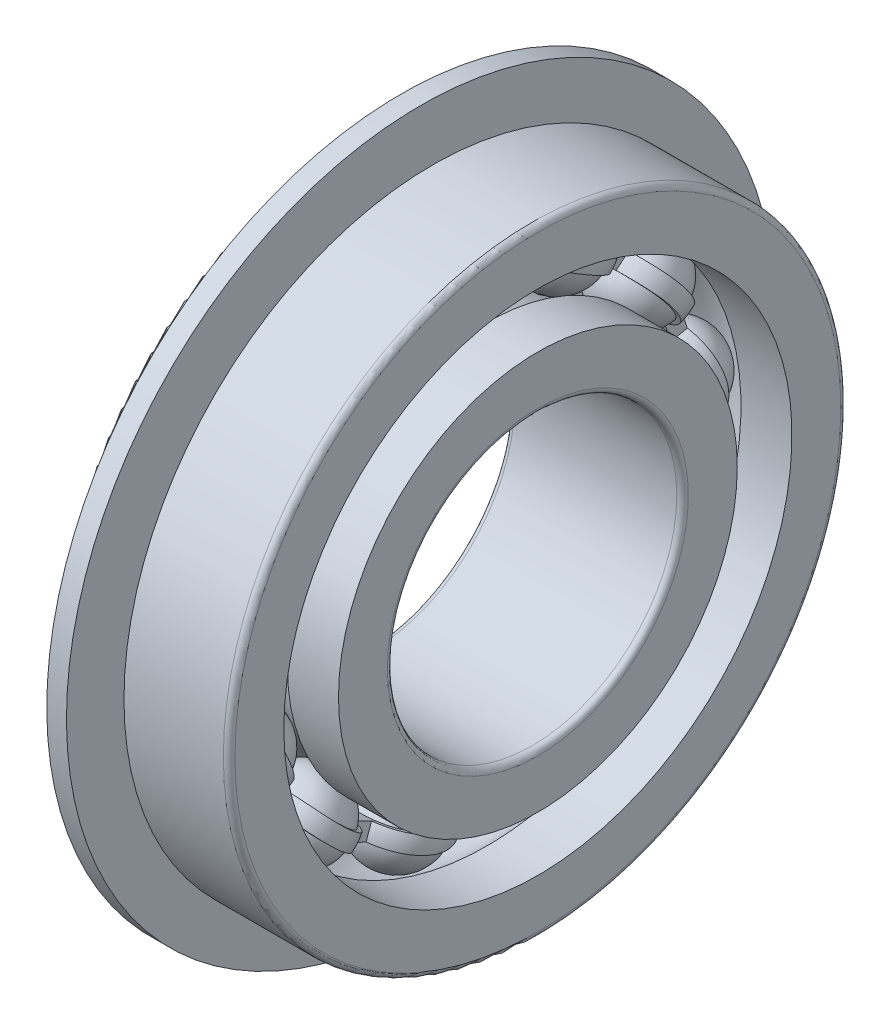
from build123d import *
from build123d.topology import SkipClean

# Parameters (mm, degrees)
SKETCH_5_W               = 1.275
SKETCH_5_H               = 0.85
PATTERN_CIRCULAR_5_COUNT = 13
PATTERN_CIRCULAR_2_COUNT = 13
SKETCH_8_W               = 1.65
SKETCH_8_H               = 1.05
CUT_EXTRUDE_START        = -1.58
CUT_EXTRUDE_1_DEPTH      = 1.02
FILLET_1_R               = 0.4


with BuildPart() as part:
    # 草图2 → 旋转1 (revolve)
    with BuildSketch(Plane.XY, mode=Mode.PRIVATE) as revolve_1_sk:
        with BuildLine():
            Line((-4.5, 13.466666667), (-4.5, 13.166666667))
            Line((-4.5, 13.166666667), (-4.2, 13.166666667))
            Line((-4.2, 13.166666667), (-1.583881484, 13.166666667))
            ThreePointArc((-1.583881484, 13.166666667), (0, 13.875), (1.583881484, 13.166666667))
            Line((1.583881484, 13.166666667), (4.2, 13.166666667))
            Line((4.2, 13.166666667), (4.5, 13.166666667))
            Line((4.5, 13.166666667), (4.5, 13.466666667))
            Line((4.5, 13.466666667), (4.5, 15.7))
            ThreePointArc((4.5, 15.7), (4.412132034, 15.912132034), (4.2, 16))
            Line((4.2, 16), (-4.2, 16))
            ThreePointArc((-4.2, 16), (-4.412132034, 15.912132034), (-4.5, 15.7))
            Line((-4.5, 15.7), (-4.5, 13.466666667))
        make_face()
        with BuildLine():
            Line((-4.2, 10.333333333), (-4.5, 10.333333333))
            Line((-4.5, 10.333333333), (-4.5, 10.033333333))
            Line((-4.5, 10.033333333), (-4.5, 7.8))
            ThreePointArc((-4.5, 7.8), (-4.412132034, 7.587867966), (-4.2, 7.5))
            Line((-4.2, 7.5), (4.2, 7.5))
            ThreePointArc((4.2, 7.5), (4.412132034, 7.587867966), (4.5, 7.8))
            Line((4.5, 7.8), (4.5, 10.033333333))
            Line((4.5, 10.033333333), (4.5, 10.333333333))
            Line((4.5, 10.333333333), (4.2, 10.333333333))
            Line((4.2, 10.333333333), (1.583881484, 10.333333333))
            ThreePointArc((1.583881484, 10.333333333), (0, 9.625), (-1.583881484, 10.333333333))
            Line((-1.583881484, 10.333333333), (-4.2, 10.333333333))
        make_face()
    revolve(revolve_1_sk.sketch.rotate(Axis((-3.5, 0, 0), (1, 0, 0)), 90), axis=Axis((-3.5, 0, 0), (1, 0, 0)))


with BuildPart() as body_2:
    # 草图5 → 旋转3 (revolve)
    with BuildSketch(Plane.XY, mode=Mode.PRIVATE) as revolve_3_sk:
        with Locations((0, 11.75)):
            Rectangle(SKETCH_5_W, SKETCH_5_H)
    revolve(revolve_3_sk.sketch.rotate(Axis((-19.927092192, 0, 0), (1, 0, 0)), 90), axis=Axis((-19.927092192, 0, 0), (1, 0, 0)))



with BuildPart() as body_3:
    # 草图3 → 旋转2 (revolve)
    with BuildSketch(Plane.XY):
        with BuildLine():
            Line((-2.3375, 11.75), (2.3375, 11.75))
            ThreePointArc((2.3375, 11.75), (0, 14.0875), (-2.3375, 11.75))
        make_face()
    revolve(axis=Axis((-2.3375, 11.75, 0), (1, 0, 0)))


with BuildPart() as pattern_circular_5_1:
    # 阵列(圆周)5: pattern copy
    add(body_3.part.rotate(Axis((0, 0, 0), (1, 0, 0)), 1 * 360 / PATTERN_CIRCULAR_5_COUNT))


with BuildPart() as pattern_circular_5_2:
    # 阵列(圆周)5: pattern copy
    add(body_3.part.rotate(Axis((0, 0, 0), (1, 0, 0)), 2 * 360 / PATTERN_CIRCULAR_5_COUNT))


with BuildPart() as pattern_circular_5_3:
    # 阵列(圆周)5: pattern copy
    add(body_3.part.rotate(Axis((0, 0, 0), (1, 0, 0)), 3 * 360 / PATTERN_CIRCULAR_5_COUNT))


with BuildPart() as pattern_circular_5_4:
    # 阵列(圆周)5: pattern copy
    add(body_3.part.rotate(Axis((0, 0, 0), (1, 0, 0)), 4 * 360 / PATTERN_CIRCULAR_5_COUNT))


with BuildPart() as pattern_circular_5_5:
    # 阵列(圆周)5: pattern copy
    add(body_3.part.rotate(Axis((0, 0, 0), (1, 0, 0)), 5 * 360 / PATTERN_CIRCULAR_5_COUNT))


with BuildPart() as pattern_circular_5_6:
    # 阵列(圆周)5: pattern copy
    add(body_3.part.rotate(Axis((0, 0, 0), (1, 0, 0)), 6 * 360 / PATTERN_CIRCULAR_5_COUNT))


with BuildPart() as pattern_circular_5_7:
    # 阵列(圆周)5: pattern copy
    add(body_3.part.rotate(Axis((0, 0, 0), (1, 0, 0)), 7 * 360 / PATTERN_CIRCULAR_5_COUNT))


with BuildPart() as pattern_circular_5_8:
    # 阵列(圆周)5: pattern copy
    add(body_3.part.rotate(Axis((0, 0, 0), (1, 0, 0)), 8 * 360 / PATTERN_CIRCULAR_5_COUNT))


with BuildPart() as pattern_circular_5_9:
    # 阵列(圆周)5: pattern copy
    add(body_3.part.rotate(Axis((0, 0, 0), (1, 0, 0)), 9 * 360 / PATTERN_CIRCULAR_5_COUNT))


with BuildPart() as pattern_circular_5_10:
    # 阵列(圆周)5: pattern copy
    add(body_3.part.rotate(Axis((0, 0, 0), (1, 0, 0)), 10 * 360 / PATTERN_CIRCULAR_5_COUNT))


with BuildPart() as pattern_circular_5_11:
    # 阵列(圆周)5: pattern copy
    add(body_3.part.rotate(Axis((0, 0, 0), (1, 0, 0)), 11 * 360 / PATTERN_CIRCULAR_5_COUNT))


with BuildPart() as pattern_circular_5_12:
    # 阵列(圆周)5: pattern copy
    add(body_3.part.rotate(Axis((0, 0, 0), (1, 0, 0)), 12 * 360 / PATTERN_CIRCULAR_5_COUNT))


with BuildPart() as cut_revolve_1_tool:
    # 草图6 → 切除-旋转1 (revolve)
    with BuildSketch(Plane.XY):
        with BuildLine():
            Line((-2.298538938, 12.175), (2.298538938, 12.175))
            ThreePointArc((2.298538938, 12.175), (0, 14.0875), (-2.298538938, 12.175))
        make_face()
        with BuildLine():
            Line((-2.298538938, 11.325), (2.298538938, 11.325))
            ThreePointArc((2.298538938, 11.325), (0, 9.4125), (-2.298538938, 11.325))
        make_face()
    revolve(axis=Axis((-19.927092192, 0, 0), (1, 0, 0)))


with BuildPart() as part_1:
    add(part.part)

    # 切除-旋转1: cut by cut_revolve_1_tool
    add(cut_revolve_1_tool.part, mode=Mode.SUBTRACT)

    # 草图8 → 切除-旋转2 (revolve, cut)
    with BuildSketch(Plane.XY, mode=Mode.PRIVATE) as cut_revolve_2_sk:
        with Locations((-1.775, 15.475)):
            Rectangle(SKETCH_8_W, SKETCH_8_H)
    revolve(cut_revolve_2_sk.sketch.rotate(Axis((-19.927092192, 0, 0), (1, 0, 0)), 90), axis=Axis((-19.927092192, 0, 0), (1, 0, 0)), mode=Mode.SUBTRACT)

    # 草图9 → 旋转5 (revolve)
    with BuildSketch(Plane.XY, mode=Mode.PRIVATE) as revolve_5_sk:
        Polygon((-2.6, 18.35), (-1.58, 18.35), (-1.58, 14.95), (-2.6, 14.95), (-2.6, 16), align=None)
    revolve(revolve_5_sk.sketch.rotate(Axis((-19.927092192, 0, 0), (1, 0, 0)), 90), axis=Axis((-19.927092192, 0, 0), (1, 0, 0)))

    # 草图11 → 切除-拉伸1 (cut)
    with SkipClean():  # the faces are left unmerged after this step: merging them gives an invalid solid
        with BuildSketch(Plane(origin=(0, 0, 0), x_dir=(0, 0, -1), z_dir=(1, 0, 0)).offset(CUT_EXTRUDE_START)):
            with BuildLine():
                Line((-1.5, -14.874558817), (-1.5, -22.02))
                Line((-1.5, -22.02), (1.5, -22.02))
                Line((1.5, -22.02), (1.5, -14.874558817))
                ThreePointArc((1.5, -14.874558817), (0, -14.95), (-1.5, -14.874558817))
            make_face()
        extrude(amount=-CUT_EXTRUDE_1_DEPTH, mode=Mode.SUBTRACT)

    # 圆角1
    fillet_1_edges = [part_1.edges().sort_by_distance(p)[0] for p in [
        (-0.95, 0, -14.95),
        (-2.6, -14.95, 0),
    ]]
    fillet(fillet_1_edges, radius=FILLET_1_R)


with BuildPart() as body_3_1:
    add(body_3.part)

    # 切除-旋转1: cut by cut_revolve_1_tool
    add(cut_revolve_1_tool.part, mode=Mode.SUBTRACT)


with BuildPart() as pattern_circular_5_1_1:
    add(pattern_circular_5_1.part)

    # 切除-旋转1: cut by cut_revolve_1_tool
    add(cut_revolve_1_tool.part, mode=Mode.SUBTRACT)


with BuildPart() as pattern_circular_5_2_1:
    add(pattern_circular_5_2.part)

    # 切除-旋转1: cut by cut_revolve_1_tool
    add(cut_revolve_1_tool.part, mode=Mode.SUBTRACT)


with BuildPart() as pattern_circular_5_3_1:
    add(pattern_circular_5_3.part)

    # 切除-旋转1: cut by cut_revolve_1_tool
    add(cut_revolve_1_tool.part, mode=Mode.SUBTRACT)


with BuildPart() as pattern_circular_5_4_1:
    add(pattern_circular_5_4.part)

    # 切除-旋转1: cut by cut_revolve_1_tool
    add(cut_revolve_1_tool.part, mode=Mode.SUBTRACT)


with BuildPart() as pattern_circular_5_5_1:
    add(pattern_circular_5_5.part)

    # 切除-旋转1: cut by cut_revolve_1_tool
    add(cut_revolve_1_tool.part, mode=Mode.SUBTRACT)


with BuildPart() as pattern_circular_5_6_1:
    add(pattern_circular_5_6.part)

    # 切除-旋转1: cut by cut_revolve_1_tool
    add(cut_revolve_1_tool.part, mode=Mode.SUBTRACT)


with BuildPart() as pattern_circular_5_7_1:
    add(pattern_circular_5_7.part)

    # 切除-旋转1: cut by cut_revolve_1_tool
    add(cut_revolve_1_tool.part, mode=Mode.SUBTRACT)


with BuildPart() as pattern_circular_5_8_1:
    add(pattern_circular_5_8.part)

    # 切除-旋转1: cut by cut_revolve_1_tool
    add(cut_revolve_1_tool.part, mode=Mode.SUBTRACT)


with BuildPart() as pattern_circular_5_9_1:
    add(pattern_circular_5_9.part)

    # 切除-旋转1: cut by cut_revolve_1_tool
    add(cut_revolve_1_tool.part, mode=Mode.SUBTRACT)


with BuildPart() as pattern_circular_5_10_1:
    add(pattern_circular_5_10.part)

    # 切除-旋转1: cut by cut_revolve_1_tool
    add(cut_revolve_1_tool.part, mode=Mode.SUBTRACT)


with BuildPart() as pattern_circular_5_11_1:
    add(pattern_circular_5_11.part)

    # 切除-旋转1: cut by cut_revolve_1_tool
    add(cut_revolve_1_tool.part, mode=Mode.SUBTRACT)


with BuildPart() as pattern_circular_5_12_1:
    add(pattern_circular_5_12.part)

    # 切除-旋转1: cut by cut_revolve_1_tool
    add(cut_revolve_1_tool.part, mode=Mode.SUBTRACT)


with BuildPart() as body_2_1:
    with SkipClean():  # the faces are left unmerged after this step: merging them gives an invalid solid
        add(body_2.part)

        add(body_3_1.part)  # 旋转4 merges body 3
        # 草图7 → 旋转4 (revolve)
        with BuildSketch(Plane.XY):
            with BuildLine():
                Line((-2.125, 11.75), (2.125, 11.75))
                ThreePointArc((2.125, 11.75), (0, 13.875), (-2.125, 11.75))
            make_face()
        revolve_4 = revolve(axis=Axis((-2.125, 11.75, 0), (1, 0, 0)))

    # 阵列(圆周)2: 旋转4 ×13 about axis
    pattern_circular_2_axis = Axis((0, 0, 0), (1, 0, 0))
    for i in range(1, PATTERN_CIRCULAR_2_COUNT):
        add(revolve_4.rotate(pattern_circular_2_axis, i * 360 / PATTERN_CIRCULAR_2_COUNT))


solid = Compound([part_1.part, pattern_circular_5_1_1.part, pattern_circular_5_2_1.part, pattern_circular_5_3_1.part, pattern_circular_5_4_1.part, pattern_circular_5_5_1.part, pattern_circular_5_6_1.part, pattern_circular_5_7_1.part, pattern_circular_5_8_1.part, pattern_circular_5_9_1.part, pattern_circular_5_10_1.part, pattern_circular_5_11_1.part, pattern_circular_5_12_1.part, body_2_1.part])
